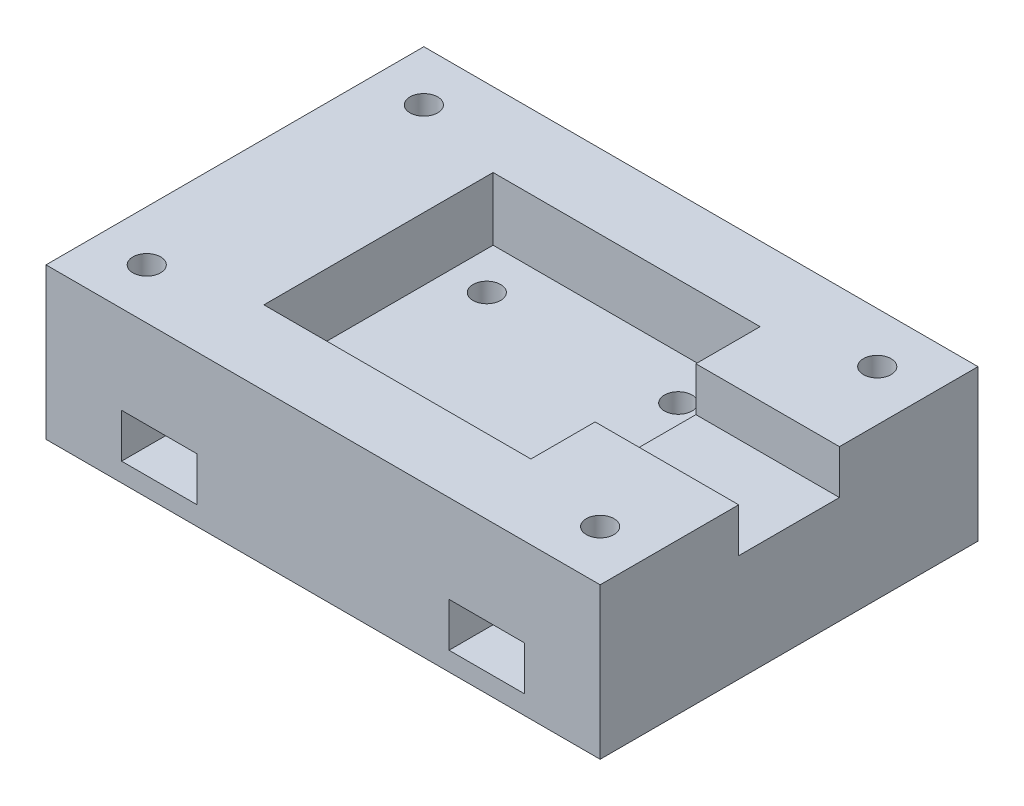
from build123d import *

# Parameters (mm, degrees)
SKETCH1_W               = 44
SKETCH1_H               = 30
POD_BODY_DEPTH          = 12
SKETCH2_W               = 21.2
SKETCH2_H               = 18.2
BOARD_POCKET_DEPTH      = 5
SKETCH3_R               = 1.1
BOARD_PILOT_HOLES_DEPTH = 9
SKETCH4_R               = 1.1
LID_PILOT_HOLES_DEPTH   = 6
SKETCH5_W               = 12.65
SKETCH5_H               = 8
CABLE_EXIT_DEPTH        = 3.5
STRAP_SLOTS_DEPTH       = 30.206163733
STRAP_SLOTS_DEPTH_BACK  = 30.206163733
SKETCH7_W               = 6
SKETCH7_H               = 3.5


with BuildPart() as part:
    # Sketch1 → Pod Body (new body)
    with BuildSketch(Plane(origin=(0, 0, 0), x_dir=(1, 0, 0), z_dir=(0, 1, 0))):
        Rectangle(SKETCH1_W, SKETCH1_H)
    extrude(amount=POD_BODY_DEPTH)

    # Sketch2 → Board Pocket (cut)
    with BuildSketch(Plane(origin=(0, 12, 0), x_dir=(1, 0, 0), z_dir=(0, 1, 0))):
        Rectangle(SKETCH2_W, SKETCH2_H)
    extrude(amount=-BOARD_POCKET_DEPTH, mode=Mode.SUBTRACT)

    # Sketch3 → Board Pilot Holes (cut)
    with BuildSketch(Plane(origin=(0, 12, 0), x_dir=(1, 0, 0), z_dir=(0, 1, 0))):
        with Locations((-7.6, 5.6)):
            Circle(SKETCH3_R)
        with Locations((7.6, 5.6)):
            Circle(SKETCH3_R)
    extrude(amount=-BOARD_PILOT_HOLES_DEPTH, mode=Mode.SUBTRACT)

    # Sketch4 → Lid Pilot Holes (cut)
    with BuildSketch(Plane(origin=(0, 12, 0), x_dir=(1, 0, 0), z_dir=(0, 1, 0))):
        with Locations((-18, -11)):
            Circle(SKETCH4_R)
        with Locations((-18, 11)):
            Circle(SKETCH4_R)
        with Locations((18, -11)):
            Circle(SKETCH4_R)
        with Locations((18, 11)):
            Circle(SKETCH4_R)
    extrude(amount=-LID_PILOT_HOLES_DEPTH, mode=Mode.SUBTRACT)

    # Sketch5 → Cable Exit (cut)
    with BuildSketch(Plane(origin=(0, 12, 0), x_dir=(1, 0, 0), z_dir=(0, 1, 0))):
        with Locations((16.675, 0)):
            Rectangle(SKETCH5_W, SKETCH5_H)
    extrude(amount=-CABLE_EXIT_DEPTH, mode=Mode.SUBTRACT)

    # Sketch7 → Strap Slots (cut, two sides: drawn at the far end of the back side and taken through both)
    with BuildSketch(Plane.XY.offset(-STRAP_SLOTS_DEPTH_BACK)):
        with Locations((-13, 3.25)):
            Rectangle(SKETCH7_W, SKETCH7_H)
        with Locations((13, 3.25)):
            Rectangle(SKETCH7_W, SKETCH7_H)
    extrude(amount=STRAP_SLOTS_DEPTH + STRAP_SLOTS_DEPTH_BACK, mode=Mode.SUBTRACT)


solid = part.part
